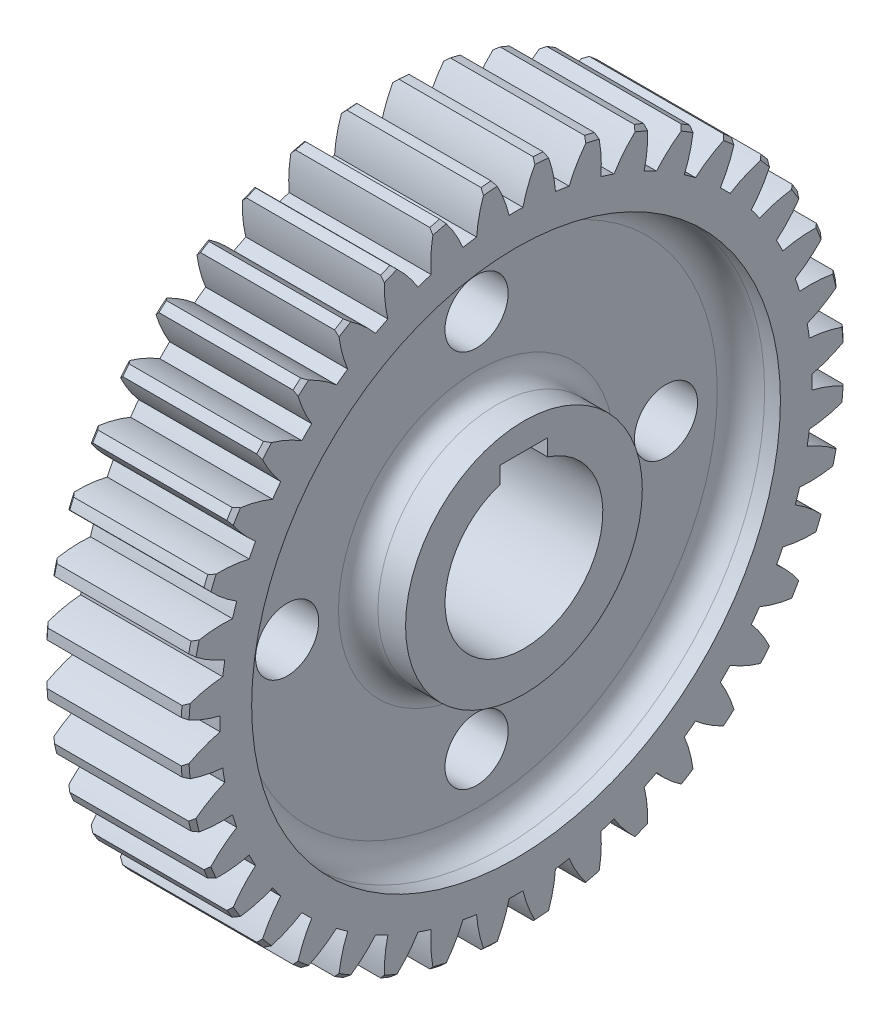
from build123d import *

# Parameters (mm, degrees)
BASPROSKE_W         = 36
BASPROSKE_H         = 84
TOOTHCUT_DEPTH      = 125.128965193
TEETHCUTS_COUNT     = 40
TEETHCUTS_ANGLE     = 351
HUBNEABOTSKE_R      = 30
HUBNEARBOTH_DEPTH   = 2.0000254
HUBFAR_START        = 2.0000254
HUBFARSKE_R         = 30
HUBFAR_DEPTH        = 2.0000254
BORSKE_R            = 20
BORE_DEPTH          = 40.0000508
KEYSKE_W            = 12
KEYSKE_H            = 23.3
KEYWAY_DEPTH        = 40.0000508
CUT_EXTRUDE_START   = -10
SKETCH_3_R          = 67
SKETCH_3_R_2        = 30
CUT_EXTRUDE_1_DEPTH = 10
FILLET_1_R          = 6
FILLET_2_R          = 5
FILLET_3_R          = 5
FILLET_4_R          = 6
SKETCH_5_R          = 8
CUT_EXTRUDE_2_DEPTH = 26


with BuildPart() as part:
    # BasProSke → Base-Revolve (revolve)
    with BuildSketch(Plane(origin=(0, 0, 0), x_dir=(1, 0, 0), z_dir=(0, 1, 0)), mode=Mode.PRIVATE) as base_revolve_sk:
        with Locations((18, 42)):
            Rectangle(BASPROSKE_W, BASPROSKE_H)
    revolve(base_revolve_sk.sketch.rotate(Axis((-10, 0, 0), (1, 0, 0)), 180), axis=Axis((-10, 0, 0), (1, 0, 0)))

    # TooCutSke → ToothCut (cut, through all)
    with BuildSketch(Plane(origin=(0, 0, 0), x_dir=(0, 0, -1), z_dir=(1, 0, 0))):
        with BuildLine():
            ThreePointArc((1.754371426, 74.978478125), (0, 74.999), (-1.754371426, 74.978478125))
            ThreePointArc((-1.754371426, 74.978478125), (-3.208173508, 79.551757122), (-5.329517378, 83.8562108))
            ThreePointArc((-5.329517378, 83.8562108), (0, 84.0254), (5.329517378, 83.8562108))
            ThreePointArc((5.329517378, 83.8562108), (3.208173508, 79.551757122), (1.754371426, 74.978478125))
        make_face()
    toothcut = extrude(amount=TOOTHCUT_DEPTH, mode=Mode.SUBTRACT)

    # TeethCuts: ToothCut ×40 about axis
    teethcuts_axis = Axis((-10, 0, 0), (1, 0, 0))
    for i in range(1, TEETHCUTS_COUNT):
        add(toothcut.rotate(teethcuts_axis, i * TEETHCUTS_ANGLE / (TEETHCUTS_COUNT - 1)), mode=Mode.SUBTRACT)

    # HubNeaBotSke → HubNearBoth (add)
    with BuildSketch(Plane.ZY):
        with Locations(Location((0, 0, 0), (0, 0, 180))):
            Circle(HUBNEABOTSKE_R)
    extrude(amount=HUBNEARBOTH_DEPTH)

    # HubFarSke → HubFar (add)
    with BuildSketch(Plane(origin=(36, 0, 0), x_dir=(0, 0, -1), z_dir=(1, 0, 0)).offset(HUBFAR_START)):
        Circle(HUBFARSKE_R)
    extrude(amount=-HUBFAR_DEPTH)

    # BorSke → Bore (cut, symmetric)
    with BuildSketch(Plane(origin=(0, 0, 0), x_dir=(0, 0, -1), z_dir=(1, 0, 0))):
        with Locations(Location((0, 0, 0), (0, 0, 180))):
            Circle(BORSKE_R)
    extrude(amount=BORE_DEPTH, both=True, mode=Mode.SUBTRACT)

    # KeySke → Keyway (cut, symmetric)
    with BuildSketch(Plane(origin=(0, 0, 0), x_dir=(0, 0, -1), z_dir=(1, 0, 0))):
        with Locations((0, 11.65)):
            Rectangle(KEYSKE_W, KEYSKE_H)
    extrude(amount=KEYWAY_DEPTH, both=True, mode=Mode.SUBTRACT)

    # 草图3 → 切除-拉伸1 (cut)
    with BuildSketch(Plane.ZY.offset(CUT_EXTRUDE_START)):
        Circle(SKETCH_3_R)
        Circle(SKETCH_3_R_2, mode=Mode.SUBTRACT)
    cut_extrude_1 = extrude(amount=CUT_EXTRUDE_1_DEPTH, mode=Mode.SUBTRACT)

    # 圆角1
    fillet_1_edges = [part.edges().sort_by_distance(p)[0] for p in [
        (10, 0, -67),
    ]]
    fillet(fillet_1_edges, radius=FILLET_1_R)

    # 圆角2
    fillet_2_edges = [part.edges().sort_by_distance(p)[0] for p in [
        (10, 0, -30),
    ]]
    fillet(fillet_2_edges, radius=FILLET_2_R)

    # 镜向3: 切除-拉伸1 across plane
    add(cut_extrude_1.mirror(Plane(origin=(18, 0, 0), x_dir=(0, 0, 1), z_dir=(1, 0, 0))), mode=Mode.SUBTRACT)

    # 圆角3
    # the kernel refuses this fillet: 5 mm, written as the material it adds along each edge
    with BuildSketch(Plane(origin=(26, 0, 0), x_dir=(0, 0, 1), z_dir=(0, -1, 0))) as fillet_3_piece_1:
        with BuildLine():
            CenterArc((30 + FILLET_3_R, -FILLET_3_R), FILLET_3_R, 90, 90)
            Line((30 + FILLET_3_R, 0), (30, 0))
            Line((30, 0), (30, -FILLET_3_R))
        make_face()
    revolve(axis=Axis((26, 0, 0), (-1, 0, 0)))

    # 圆角4
    fillet_4_edges = [part.edges().sort_by_distance(p)[0] for p in [
        (26, 0, -67),
    ]]
    fillet(fillet_4_edges, radius=FILLET_4_R)

    # 草图5 → 切除-拉伸2 (cut)
    with BuildSketch(Plane.ZY.offset(-10)):
        with Locations((0, 48)):
            Circle(SKETCH_5_R)
        with Locations((0, -48)):
            Circle(SKETCH_5_R)
        with Locations((48, 0)):
            Circle(SKETCH_5_R)
        with Locations((-48, 0)):
            Circle(SKETCH_5_R)
    extrude(amount=-CUT_EXTRUDE_2_DEPTH, mode=Mode.SUBTRACT)

    # 草图7 → 切除-旋转1 (revolve, cut)
    with BuildSketch(Plane.XY, mode=Mode.PRIVATE) as cut_revolve_1_sk:
        Polygon((-0.921881053, 85.323828485), (1, 84), (0, 83), align=None)
        Polygon((38.683090241, 85.323828485), (36, 83), (35, 84), align=None)
    revolve(cut_revolve_1_sk.sketch.rotate(Axis((38.0000254, 0, 0), (-1, 0, 0)), 90), axis=Axis((38.0000254, 0, 0), (-1, 0, 0)), mode=Mode.SUBTRACT)


solid = part.part
